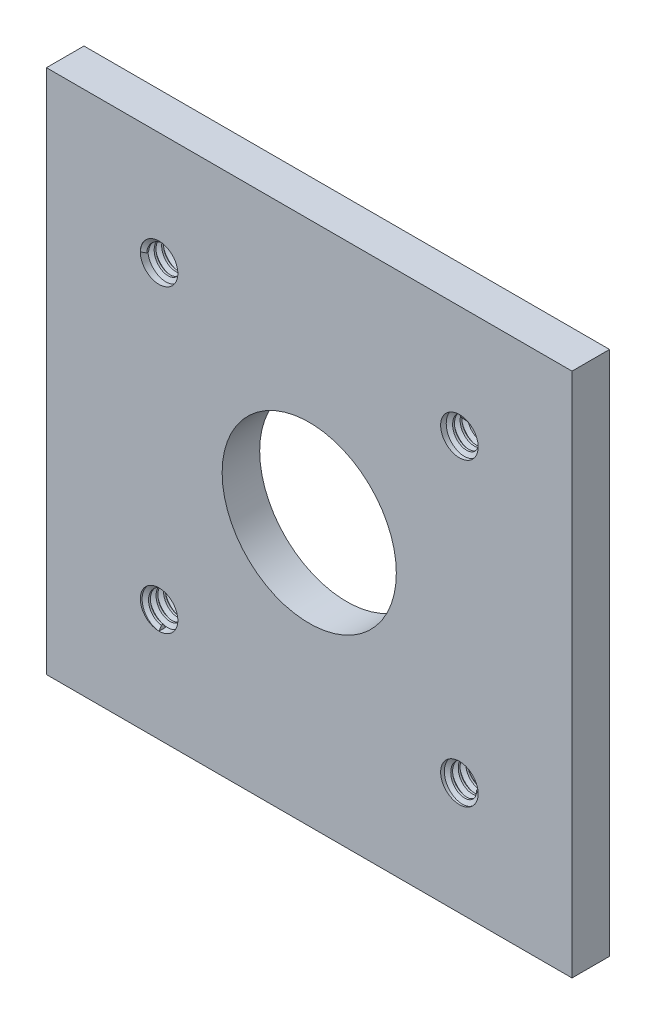
from build123d import *

# Parameters (mm, degrees)
SKETCH1_W           = 88.9
SKETCH1_H           = 88.9
SKETCH1_R           = 14.732
SKETCH1_R_2         = 3.175
BOSS_EXTRUDE1_DEPTH = 6.35
THREAD1_PITCH       = 1.27
CIRPATTERN1_COUNT   = 4
SKETCH5_W           = 88.9
SKETCH5_H           = 88.9
CUT_EXTRUDE1_DEPTH  = 6.35


with BuildPart() as part:
    # Sketch1 → Boss-Extrude1 (new body)
    with BuildSketch(Plane.XY):
        Rectangle(SKETCH1_W, SKETCH1_H)
        Circle(SKETCH1_R, mode=Mode.SUBTRACT)
        with Locations((-25.4, 25.4)):
            Circle(SKETCH1_R_2, mode=Mode.SUBTRACT)
        with Locations((25.4, 25.4)):
            Circle(SKETCH1_R_2, mode=Mode.SUBTRACT)
        with Locations((25.4, -25.4)):
            Circle(SKETCH1_R_2, mode=Mode.SUBTRACT)
        with Locations((-25.4, -25.4)):
            Circle(SKETCH1_R_2, mode=Mode.SUBTRACT)
    extrude(amount=BOSS_EXTRUDE1_DEPTH)

    # Thread1: the profile of Thread Profile1 profile screwed along a right-hand helix of 5 turns, 8 arcs to a turn; built about Z, then put on its axis
    thread1_z = Axis((0, 0, 0), (0, 0, 1))
    thread1_corners = [(3.1753, 0, -0.000173205), (3.1753, 0, 1.111423202), (2.487592339, 0, 0.714374998), (2.487592339, 0, 0.396874998)]
    with BuildLine(mode=Mode.PRIVATE) as thread1_profile:
        Line(thread1_corners[0], thread1_corners[1])
        Line(thread1_corners[1], thread1_corners[2])
        Line(thread1_corners[2], thread1_corners[3])
        Line(thread1_corners[3], thread1_corners[0])
    thread1_cap = Face(thread1_profile.wire())
    thread1_turn_angles = [0, 22.5, 45, 67.5, 90, 112.5, 135, 157.5, 180, 202.5, 225, 247.5, 270, 292.5, 315, 337.5, 360]
    thread1_turn_weights = [1, 0.9238795325112867, 1, 0.9238795325112867, 1, 0.9238795325112867, 1, 0.9238795325112867, 1, 0.9238795325112867, 1, 0.9238795325112867, 1, 0.9238795325112867, 1, 0.9238795325112867, 1]
    thread1_turn_rails = [Edge.make_bspline([Vector(p[0], p[1], 0).rotate(thread1_z, thread1_turn_angles[k]) / thread1_turn_weights[k] + Vector(0, 0, p[2] + THREAD1_PITCH * thread1_turn_angles[k] / 360) for k in range(17)], [0, 0, 0, 1, 1, 2, 2, 3, 3, 4, 4, 5, 5, 6, 6, 7, 7, 8, 8, 8], 2, thread1_turn_weights) for p in thread1_corners]
    thread1_turn_sides = [Face.make_surface_from_curves(thread1_turn_rails[p[0]], thread1_turn_rails[p[1]]) for p in [(0, 1), (1, 2), (2, 3), (3, 0)]]
    thread1 = Plane(origin=(-25.4, 25.4, 6.35), x_dir=(-1, 0, 0), z_dir=(0, 0, -1)) * Solid(Shell([*[p.moved(Location((0, 0, THREAD1_PITCH * i))) for i in range(5) for p in thread1_turn_sides], thread1_cap, thread1_cap.rotate(thread1_z, 1800).moved(Location((0, 0, THREAD1_PITCH * 1800 / 360)))]))
    add(thread1)

    # CirPattern1: Thread1 ×4 about axis
    cirpattern1_axis = Axis((0, 0, 6.35), (0, 0, 1))
    for i in range(1, CIRPATTERN1_COUNT):
        add(thread1.rotate(cirpattern1_axis, i * 360 / CIRPATTERN1_COUNT))

    # Sketch5 → Cut-Extrude1 (cut)
    with BuildSketch(Plane(origin=(0, 0, 0), x_dir=(-1, 0, 0), z_dir=(0, 0, -1))):
        Rectangle(SKETCH5_W, SKETCH5_H)
    extrude(amount=CUT_EXTRUDE1_DEPTH, mode=Mode.SUBTRACT)


solid = part.part
